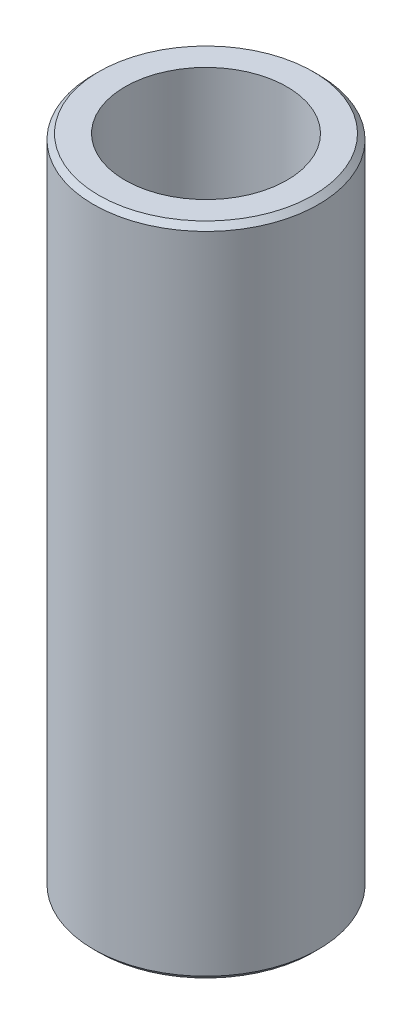
from build123d import *

# Parameters (mm, degrees)
SKETCH1_R           = 60
BOSS_EXTRUDE1_DEPTH = 349.753377044
SKETCH2_R           = 43.196709697
CUT_EXTRUDE1_DEPTH  = 360.899186932
CHAMFER1_SIZE       = 2.836556146


with BuildPart() as part:
    # Sketch1 → Boss-Extrude1 (new body)
    with BuildSketch(Plane(origin=(0, 0, 0), x_dir=(1, 0, 0), z_dir=(0, 1, 0))):
        Circle(SKETCH1_R)
    extrude(amount=BOSS_EXTRUDE1_DEPTH)

    # Sketch2 → Cut-Extrude1 (cut, through all)
    with BuildSketch(Plane(origin=(0, 0, 0), x_dir=(1, 0, 0), z_dir=(0, 1, 0))):
        Circle(SKETCH2_R)
    extrude(amount=CUT_EXTRUDE1_DEPTH, mode=Mode.SUBTRACT)

    # Chamfer1
    chamfer1_edges = [part.edges().sort_by_distance(p)[0] for p in [
        (-60, 349.753377044, 0),
        (-60, 0, 0),
    ]]
    chamfer(chamfer1_edges, length=CHAMFER1_SIZE)


solid = part.part
